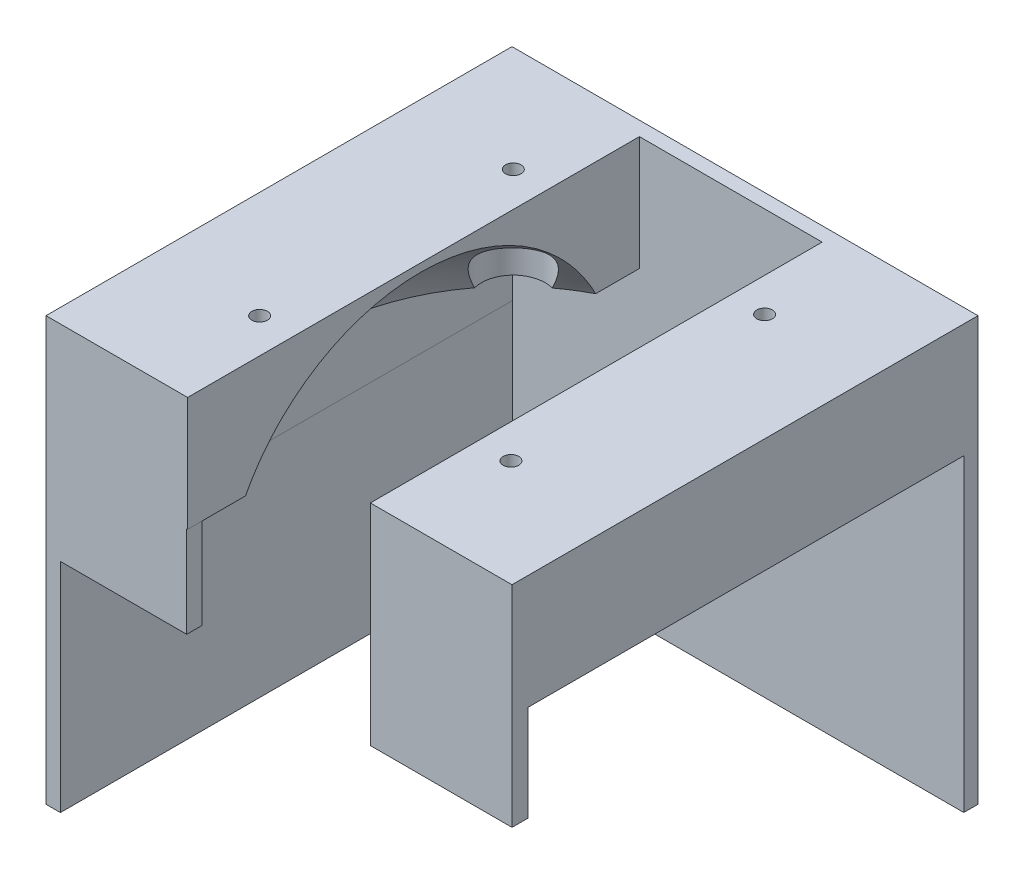
from build123d import *
from build123d.topology import SkipClean

# Parameters (mm, degrees)
SKETCH1_W                   = 102
SKETCH1_H                   = 102
BOSS_EXTRUDE1_DEPTH         = 50
CUT_EXTRUDE_THIN1_OUTLINE_W = 40
CUT_EXTRUDE_THIN1_OUTLINE_H = 95.773670058
CUT_EXTRUDE_THIN1_DEPTH     = 50
SKETCH4_W                   = 40
SKETCH4_H                   = 6.202657501
CUT_EXTRUDE3_DEPTH          = 54
SKETCH5_W                   = 33.817621941
SKETCH5_H                   = 102.594578927
CUT_EXTRUDE4_DEPTH          = 20
SKETCH6_W                   = 27.820383201
SKETCH6_H                   = 98.886835029
CUT_EXTRUDE5_DEPTH          = 20
SKETCH7_W                   = 30.8
SKETCH7_H                   = 3.364819678
BOSS_EXTRUDE2_DEPTH         = 21
SKETCH9_W                   = 31
SKETCH9_H                   = 3.479961613
BOSS_EXTRUDE4_DEPTH         = 21
SKETCH10_W                  = 3.15002448
SKETCH10_H                  = 102
BOSS_EXTRUDE5_DEPTH         = 47.625
SKETCH11_W                  = 98.820383201
SKETCH11_H                  = 3.113164971
BOSS_EXTRUDE6_DEPTH         = 47.625
SKETCH14_W                  = 102
SKETCH14_H                  = 5
CUT_EXTRUDE7_DEPTH          = 105
SKETCH17_R                  = 7
CUT_EXTRUDE12_DEPTH         = 20.5
M3_CLEARANCE_HOLE1_D        = 3.4


# Read off the part's stored shape, not the designer's step: Cut-Extrude-Thin1
with BuildPart() as part:
    # Sketch1 → Boss-Extrude1 (new body)
    with BuildSketch(Plane(origin=(0, 0, 0), x_dir=(1, 0, 0), z_dir=(0, 1, 0))):
        with Locations((-66.567363259, 25.977216604)):
            Rectangle(SKETCH1_W, SKETCH1_H)
    extrude(amount=BOSS_EXTRUDE1_DEPTH)

    # Sketch2 → Cut-Revolve1 (revolve, cut)
    with SkipClean():  # the faces are left unmerged after this step: merging them gives an invalid solid
        with BuildSketch(Plane(origin=(0, 0, 0), x_dir=(1, 0, 0), z_dir=(0, 1, 0))):
            with BuildLine():
                ThreePointArc((-66.567363259, 73.602216604), (-114.192363259, 25.977216604), (-66.567363259, -21.647783396))
                Line((-66.567363259, -21.647783396), (-66.567363259, 73.602216604))
            make_face()
            with BuildLine():
                Line((-66.567363259, 73.602216604), (-66.567363259, -21.647783396))
                ThreePointArc((-66.567363259, -21.647783396), (-32.891402805, -7.69874385), (-18.942363259, 25.977216604))
                ThreePointArc((-18.942363259, 25.977216604), (-32.891402805, 59.653177058), (-66.567363259, 73.602216604))
            make_face()
        revolve(axis=Axis((-66.567363259, 0, 21.647783396), (0, 0, -1)), mode=Mode.SUBTRACT)
    add(part.part.scale(1), mode=Mode.REPLACE)  # the faces are merged on a copy

    # Cut-Extrude-Thin1 outline → Cut-Extrude-Thin1 (cut)
    with BuildSketch(Plane(origin=(0, 0, 0), x_dir=(1, 0, 0), z_dir=(0, 1, 0))):
        with Locations((-66.567363259, 25.977216604)):
            Rectangle(CUT_EXTRUDE_THIN1_OUTLINE_W, CUT_EXTRUDE_THIN1_OUTLINE_H)
    extrude(amount=CUT_EXTRUDE_THIN1_DEPTH, mode=Mode.SUBTRACT)

    # Sketch4 → Cut-Extrude3 (cut)
    with BuildSketch(Plane(origin=(0, 0, 0), x_dir=(1, 0, 0), z_dir=(0, 1, 0))):
        with Locations((-66.567363259, -25.010947176)):
            Rectangle(SKETCH4_W, SKETCH4_H)
    extrude(amount=CUT_EXTRUDE3_DEPTH, mode=Mode.SUBTRACT)

    # Sketch5 → Cut-Extrude4 (cut)
    with BuildSketch(Plane(origin=(0, 0, 0), x_dir=(1, 0, 0), z_dir=(0, 1, 0))):
        with Locations((-29.658552289, 22.56676217)):
            Rectangle(SKETCH5_W, SKETCH5_H)
    extrude(amount=CUT_EXTRUDE4_DEPTH, mode=Mode.SUBTRACT)

    # Sketch6 → Cut-Extrude5 (cut)
    with BuildSketch(Plane(origin=(0, 0, 0), x_dir=(-1, 0, 0), z_dir=(0, -1, 0))):
        with Locations((100.47755486, 24.420634119)):
            Rectangle(SKETCH6_W, SKETCH6_H)
    extrude(amount=-CUT_EXTRUDE5_DEPTH, mode=Mode.SUBTRACT)

    # Sketch7 → Boss-Extrude2 (add)
    with BuildSketch(Plane(origin=(0, 0, 0), x_dir=(1, 0, 0), z_dir=(0, 1, 0))):
        with Locations((-102.167363259, -23.340373557)):
            Rectangle(SKETCH7_W, SKETCH7_H)
    extrude(amount=BOSS_EXTRUDE2_DEPTH)

    # Sketch9 → Boss-Extrude4 (add)
    with BuildSketch(Plane.XZ.offset(-20)):
        with Locations((-31.067363259, 23.28280259)):
            Rectangle(SKETCH9_W, SKETCH9_H)
    extrude(amount=BOSS_EXTRUDE4_DEPTH)

    # Sketch10 → Boss-Extrude5 (add)
    with BuildSketch(Plane.XZ):
        with Locations((-115.992351019, -25.977216604)):
            Rectangle(SKETCH10_W, SKETCH10_H)
    extrude(amount=BOSS_EXTRUDE5_DEPTH)

    # Sketch11 → Boss-Extrude6 (add)
    with BuildSketch(Plane.XZ):
        with Locations((-64.97755486, -75.420634119)):
            Rectangle(SKETCH11_W, SKETCH11_H)
    extrude(amount=BOSS_EXTRUDE6_DEPTH)

    # Sketch14 → Cut-Extrude7 (cut)
    with BuildSketch(Plane(origin=(-15.567363259, 0, 0), x_dir=(0, 0, -1), z_dir=(1, 0, 0))):
        with Locations((25.977216604, 47.5)):
            Rectangle(SKETCH14_W, SKETCH14_H)
    extrude(amount=-CUT_EXTRUDE7_DEPTH, mode=Mode.SUBTRACT)

    # Sketch17 → Cut-Extrude12 (cut)
    with BuildSketch(Plane.XZ.offset(-20)):
        with Locations(Location((-94.167363259, 1.657963718, 0), (0, 0, 270))):
            Circle(SKETCH17_R)
        with Locations(Location((-94.167363259, -53.864051633, 0), (0, 0, 284.685382437))):
            Circle(SKETCH17_R)
        with Locations(Location((-39.167363259, 1.657963718, 0), (0, 0, 349.246729183))):
            Circle(SKETCH17_R)
        with Locations(Location((-39.167363259, -53.864051633, 0), (0, 0, 270))):
            Circle(SKETCH17_R)
    extrude(amount=-CUT_EXTRUDE12_DEPTH, mode=Mode.SUBTRACT)

    # M3 Clearance Hole1 (through all)
    with Locations(Plane(origin=(0, 40.5, 0), x_dir=(-1, 0, 0), z_dir=(0, -1, 0))):
        with Locations((94.167363259, -1.657963718), (39.167363259, -1.657963718), (39.167363259, 53.864051633), (94.167363259, 53.864051633)):
            Hole(M3_CLEARANCE_HOLE1_D / 2)


solid = part.part
